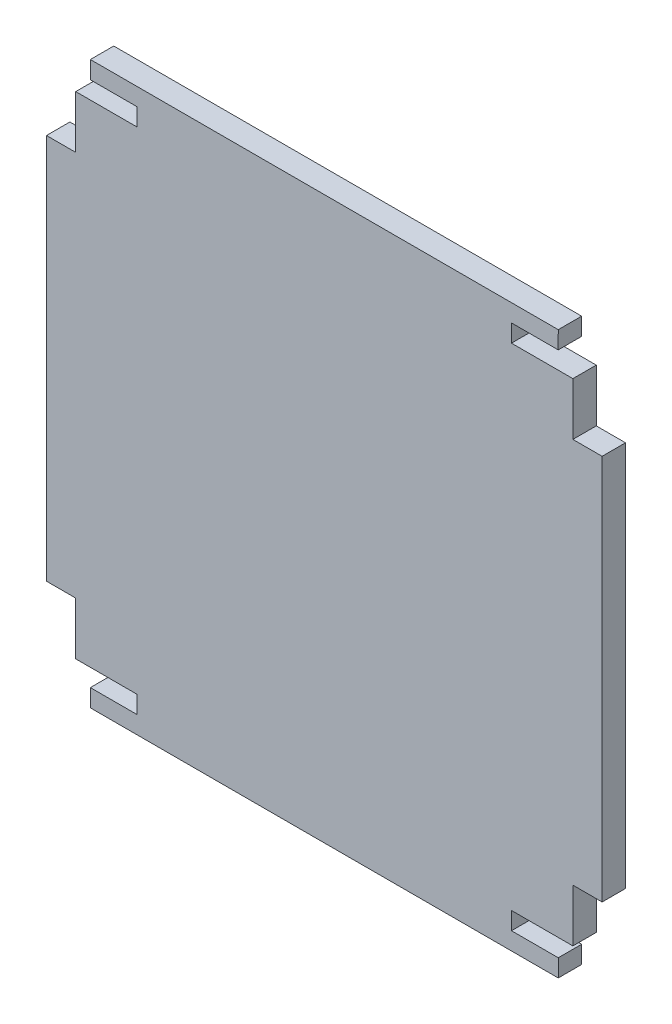
from build123d import *

# Parameters (mm, degrees)
BOSS_EXTRUDE1_DEPTH = 4


with BuildPart() as part:
    # Sketch1 → Boss-Extrude1 (new body)
    with BuildSketch(Plane.XY):
        Polygon((-42.499999951, 41.999999908), (-42.499999951, 33.000000092), (-47.499999951, 33.000000092), (-47.499999951, -32.999999908), (-42.499999951, -32.999999908), (-42.499999951, -41.999999908), (-31.999999951, -41.999999908), (-31.999999951, -44.999999908), (-39.999999951, -44.999999908), (-39.999999951, -47.999999908), (40.000000049, -47.999999908), (40.000000049, -44.999999908), (32.000000049, -44.999999908), (32.000000049, -41.999999908), (42.499999951, -41.999999908), (42.500000049, -32.999999908), (47.500000049, -32.999999908), (47.500000049, 33.000000092), (42.500000049, 33.000000092), (42.499999951, 41.999999908), (32.000000049, 42.000000092), (32.000000049, 45.000000092), (39.99603642, 45.000000092), (40.000000049, 48.000000092), (-39.999999951, 48.000000092), (-39.999999951, 45.000000092), (-31.999999951, 45.000000092), (-31.999999951, 42.000000092), align=None)
    extrude(amount=BOSS_EXTRUDE1_DEPTH)


solid = part.part
